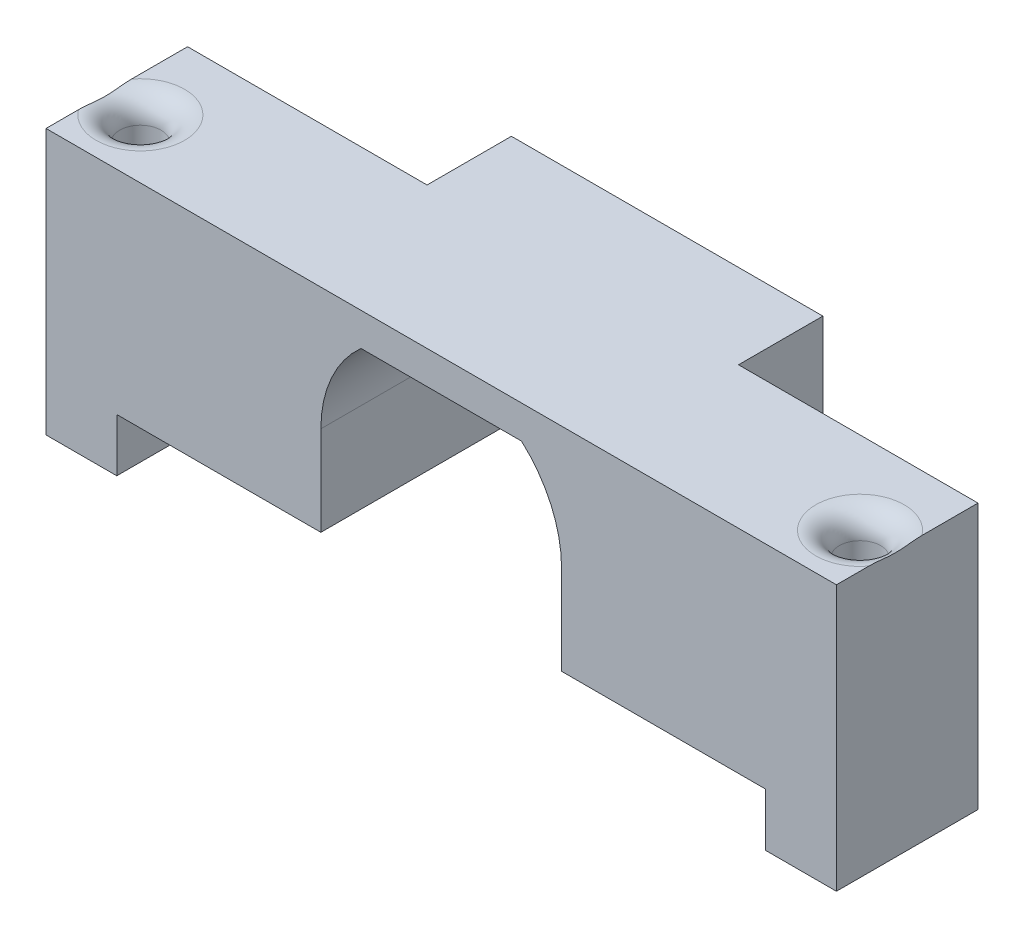
from build123d import *

# Parameters (mm, degrees)
BOSS_EXTRUDE2_DEPTH = 12
SKETCH2_W           = 12
SKETCH2_H           = 22.5
BOSS_EXTRUDE3_DEPTH = 6
SKETCH3_W           = 12
SKETCH3_H           = 22.5
BOSS_EXTRUDE4_DEPTH = 6
SKETCH4_R           = 1.75
CUT_EXTRUDE1_DEPTH  = 22.5
FILLET1_R           = 2
BOSS_EXTRUDE5_START = 4.65
BOSS_EXTRUDE5_DEPTH = 4.65
SKETCH6_W           = 26.4
SKETCH6_H           = 18
SKETCH6_R           = 4.925
BOSS_EXTRUDE6_DEPTH = 2.5


with BuildPart() as part:
    # Sketch1 → Boss-Extrude2 (new body)
    with BuildSketch(Plane.XY):
        Polygon((0, 18), (0, 0), (17.3, 0), (17.3, 7.6), (17.3, 15.2), (20.697059459, 15.2), (34.302940541, 15.2), (37.7, 15.2), (37.7, 7.6), (37.7, 0), (55, 0), (55, 18), align=None)
        with BuildLine():
            Line((17.3, 15.2), (17.3, 7.6))
            ThreePointArc((17.3, 7.6), (18.187911257, 11.762331467), (20.697059459, 15.2))
            Line((20.697059459, 15.2), (17.3, 15.2))
        make_face()
        with BuildLine():
            Line((37.7, 15.2), (34.302940541, 15.2))
            ThreePointArc((34.302940541, 15.2), (36.812088743, 11.762331467), (37.7, 7.6))
            Line((37.7, 7.6), (37.7, 15.2))
        make_face()
    extrude(amount=BOSS_EXTRUDE2_DEPTH)

    # Sketch2 → Boss-Extrude3 (add)
    with BuildSketch(Plane.ZY):
        with Locations((6, 6.75)):
            Rectangle(SKETCH2_W, SKETCH2_H)
    extrude(amount=BOSS_EXTRUDE3_DEPTH)

    # Sketch3 → Boss-Extrude4 (add)
    with BuildSketch(Plane(origin=(55, 0, 0), x_dir=(0, 0, -1), z_dir=(1, 0, 0))):
        with Locations((-6, 6.75)):
            Rectangle(SKETCH3_W, SKETCH3_H)
    extrude(amount=BOSS_EXTRUDE4_DEPTH)

    # Sketch4 → Cut-Extrude1 (cut)
    with BuildSketch(Plane(origin=(0, 18, 0), x_dir=(1, 0, 0), z_dir=(0, 1, 0))):
        with Locations(Location((-3, -7, 0), (0, 0, 270))):
            Circle(SKETCH4_R)
        with Locations(Location((58, -7, 0), (0, 0, 270))):
            Circle(SKETCH4_R)
    extrude(amount=-CUT_EXTRUDE1_DEPTH, mode=Mode.SUBTRACT)

    # Fillet1
    # the kernel refuses this fillet: 2 mm, written as the material it takes off along each edge
    with BuildSketch(Plane(origin=(-3, 18, 7), x_dir=(0, 0, 1), z_dir=(-1, 0, 0))) as fillet1_piece_1:
        with BuildLine():
            CenterArc((1.75 + FILLET1_R, -FILLET1_R), FILLET1_R, 90, 90)
            Line((1.75, -FILLET1_R), (1.75, 0))
            Line((1.75, 0), (1.75 + FILLET1_R, 0))
        make_face()
    revolve(axis=Axis((-3, 18, 7), (0, 1, 0)), mode=Mode.SUBTRACT)
    with BuildSketch(Plane(origin=(58, 18, 7), x_dir=(0, 0, 1), z_dir=(-1, 0, 0))) as fillet1_piece_2:
        with BuildLine():
            CenterArc((1.75 + FILLET1_R, -FILLET1_R), FILLET1_R, 90, 90)
            Line((1.75, -FILLET1_R), (1.75, 0))
            Line((1.75, 0), (1.75 + FILLET1_R, 0))
        make_face()
    revolve(axis=Axis((58, 18, 7), (0, 1, 0)), mode=Mode.SUBTRACT)

    # Sketch5 → Boss-Extrude5 (add)
    with BuildSketch(Plane(origin=(0, 0, 0), x_dir=(-1, 0, 0), z_dir=(0, 0, -1)).offset(BOSS_EXTRUDE5_START)):
        with BuildLine():
            Line((-37.7, 0), (-40.7, 0))
            Line((-40.7, 0), (-40.7, 18))
            Line((-40.7, 18), (-14.3, 18))
            Line((-14.3, 18), (-14.3, 0))
            Line((-14.3, 0), (-17.3, 0))
            Line((-17.3, 0), (-17.3, 6))
            ThreePointArc((-17.3, 6), (-18.898767331, 7.537206525), (-17.425490196, 9.195071224))
            ThreePointArc((-17.425490196, 9.195071224), (-18.543054375, 12.47986937), (-20.697059459, 15.2))
            Line((-20.697059459, 15.2), (-34.302940541, 15.2))
            ThreePointArc((-34.302940541, 15.2), (-36.456945625, 12.47986937), (-37.574509804, 9.195071224))
            ThreePointArc((-37.574509804, 9.195071224), (-36.101232669, 7.537206525), (-37.7, 6))
            Line((-37.7, 6), (-37.7, 0))
        make_face()
    extrude(amount=-BOSS_EXTRUDE5_DEPTH)

    # Sketch6 → Boss-Extrude6 (add)
    with BuildSketch(Plane(origin=(0, 0, -4.65), x_dir=(-1, 0, 0), z_dir=(0, 0, -1))):
        with Locations((-27.5, 9)):
            Rectangle(SKETCH6_W, SKETCH6_H)
        with Locations((-27.5, 7.537206525)):
            Circle(SKETCH6_R, mode=Mode.SUBTRACT)
    extrude(amount=BOSS_EXTRUDE6_DEPTH)


solid = part.part
